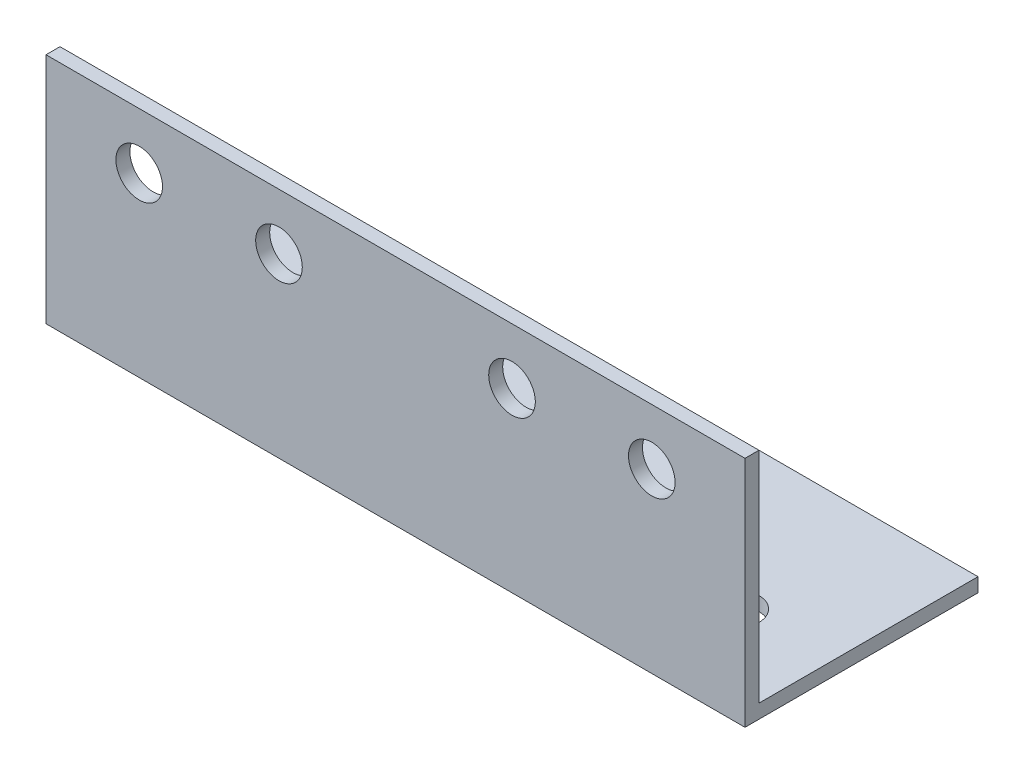
from build123d import *

# Parameters (mm, degrees)
EXTRUDE_1_DEPTH     = 150
SKETCH_2_R          = 5
CUT_EXTRUDE_1_DEPTH = 166.831239518
SKETCH_3_R          = 5
CUT_EXTRUDE_2_DEPTH = 166.831239518


with BuildPart() as part:
    # Эскиз1 → Вытянуть-Тонкостенный1 (new body)
    with BuildSketch(Plane(origin=(0, 0, 0), x_dir=(0, 0, -1), z_dir=(1, 0, 0))):
        Polygon((50, 0), (0, 0), (0, 50), (3, 50), (3, 3), (50, 3), align=None)
    extrude(amount=EXTRUDE_1_DEPTH)

    # Эскиз2 → Вырез-Вытянуть1 (cut, through all)
    with BuildSketch(Plane.XY):
        with Locations((20, 38)):
            Circle(SKETCH_2_R)
        with Locations((50, 38)):
            Circle(SKETCH_2_R)
        with Locations((100, 38)):
            Circle(SKETCH_2_R)
        with Locations((130, 38)):
            Circle(SKETCH_2_R)
    extrude(amount=-CUT_EXTRUDE_1_DEPTH, mode=Mode.SUBTRACT)

    # Эскиз3 → Вырез-Вытянуть2 (cut, through all)
    with BuildSketch(Plane.XZ):
        with Locations((130, -18)):
            Circle(SKETCH_3_R)
        with Locations((100, -18)):
            Circle(SKETCH_3_R)
        with Locations((50, -18)):
            Circle(SKETCH_3_R)
        with Locations((20, -18)):
            Circle(SKETCH_3_R)
    extrude(amount=-CUT_EXTRUDE_2_DEPTH, mode=Mode.SUBTRACT)


solid = part.part
